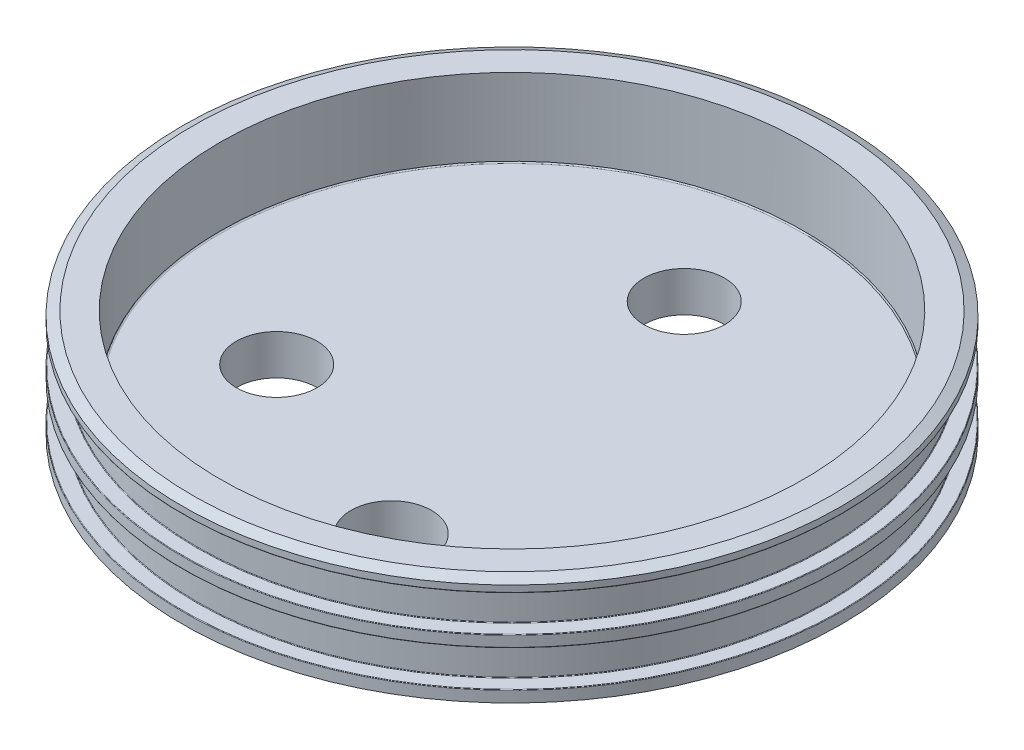
from build123d import *

# Parameters (mm, degrees)
SKETCH6_R                                = 66.04
BOSS_EXTRUDE1_DEPTH                      = 2.54
CNC_ID_FILLET_R                          = 0.127
CNC_OD_FILLET_R                          = 0.127
CNC_CHAMFERS_SIZE                        = 1.016
CNC_CHAMFERS_SIZE2                       = 2.178819031
CNC_BORE_FILLET_R                        = 0.254
PIPE_TAP_DRILL_FOR_1_2_TAP_FILL_VALVE_D  = 17.8562
PIPE_TAP_DRILL_FOR_1_4_TAP_SOLENOID_VA_D = 17.8562
PIPE_TAP_DRILL_FOR_1_2_TAP_CRYO_VALVE_D  = 17.8562


with BuildPart() as part:
    # Sketch1 → Revolve1 (revolve)
    with BuildSketch(Plane.XY):
        Polygon((0, 0), (72.898, 0), (72.898, 2.54), (69.6468, 2.54), (69.6468, 10.541), (72.898, 10.541), (72.898, 13.081), (69.6468, 13.081), (69.6468, 21.082), (72.898, 21.082), (72.898, 23.622), (64.5668, 23.622), (64.5668, 6.35), (0, 6.35), align=None)
    revolve(axis=Axis((0, 48.192213231, 0), (0, -1, 0)))

    # Sketch6 → Boss-Extrude1 (add)
    with BuildSketch(Plane.XZ):
        Circle(SKETCH6_R)
    extrude(amount=BOSS_EXTRUDE1_DEPTH)

    # CNC ID Fillet
    cnc_id_fillet_edges = [part.edges().sort_by_distance(p)[0] for p in [
        (-69.6468, 10.541, 0),
        (-69.6468, 2.54, 0),
        (-66.04, 0, 0),
        (-69.6468, 21.082, 0),
        (-69.6468, 13.081, 0),
    ]]
    fillet(cnc_id_fillet_edges, radius=CNC_ID_FILLET_R)

    # CNC OD Fillet
    cnc_od_fillet_edges = [part.edges().sort_by_distance(p)[0] for p in [
        (-72.898, 10.541, 0),
        (-72.898, 2.54, 0),
        (-72.898, 13.081, 0),
        (-72.898, 21.082, 0),
        (-66.04, -2.54, 0),
    ]]
    fillet(cnc_od_fillet_edges, radius=CNC_OD_FILLET_R)

    # CNC Chamfers
    cnc_chamfers_edges = [part.edges().sort_by_distance(p)[0] for p in [
        (-72.898, 23.622, 0),
    ]]
    cnc_chamfers_side = [part.faces().sort_by_distance(p)[0] for p in [
        (-72.898, 22.4155, 0),
    ]]
    chamfer(cnc_chamfers_edges, length=CNC_CHAMFERS_SIZE, length2=CNC_CHAMFERS_SIZE2, reference=cnc_chamfers_side[0])

    # CNC Bore Fillet
    cnc_bore_fillet_edges = [part.edges().sort_by_distance(p)[0] for p in [
        (-64.5668, 6.35, 0),
    ]]
    fillet(cnc_bore_fillet_edges, radius=CNC_BORE_FILLET_R)

    # Pipe Tap Drill for 1/2 Tap - Fill Valve (through all)
    with Locations(Plane(origin=(0, -2.54, 0), x_dir=(-1, 0, 0), z_dir=(0, -1, 0))):
        with Locations((0, 38.1)):
            Hole(PIPE_TAP_DRILL_FOR_1_2_TAP_FILL_VALVE_D / 2)

    # Pipe Tap Drill for 1/4 Tap - Solenoid Valve (through all)
    with Locations(Plane(origin=(0, -2.54, 0), x_dir=(-1, 0, 0), z_dir=(0, -1, 0))):
        with Locations((-12.089248859, -38.800253376)):
            Hole(PIPE_TAP_DRILL_FOR_1_4_TAP_SOLENOID_VA_D / 2)

    # Pipe Tap Drill for 1/2 Tap - Cryo Valve (through all)
    with Locations(Plane(origin=(0, -2.54, 0), x_dir=(-1, 0, 0), z_dir=(0, -1, 0))):
        with Locations((32.995567884, -19.05)):
            Hole(PIPE_TAP_DRILL_FOR_1_2_TAP_CRYO_VALVE_D / 2)


solid = part.part
